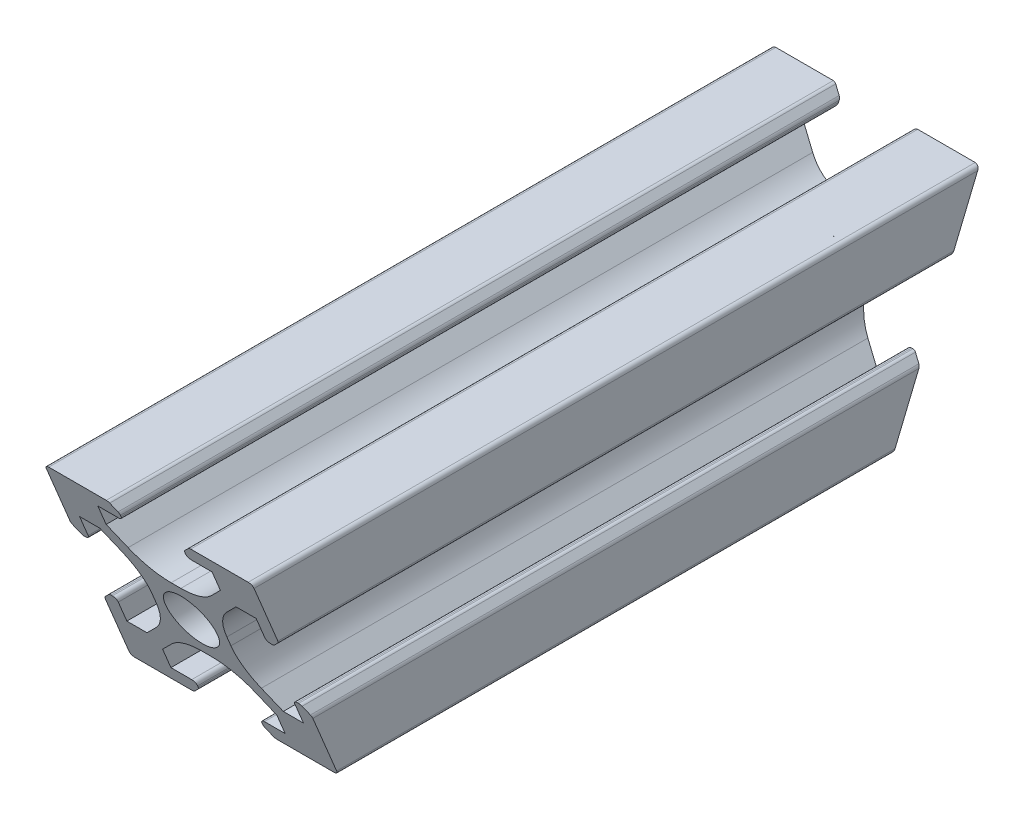
from build123d import *

# Parameters (mm, degrees)
RESSALTO_EXTRUS_O1_DEPTH = 70
PADR_OCIRCULAR1_COUNT    = 4
FILETE1_R                = 0.4
CUT_EXTRUDE1_DEPTH       = 74.484692283
SKETCH2_R                = 1.5
CUT_EXTRUDE2_DEPTH       = 74.484692283


with BuildPart() as part:
    # Esboço1 → Ressalto-extrusão1 (new body)
    with BuildSketch(Plane.XY):
        with BuildLine():
            ThreePointArc((-9.317157288, 3.217157288), (-9.187387948, 3.130448187), (-9.034314575, 3.1))
            Line((-9.034314575, 3.1), (-8.9, 3.1))
            ThreePointArc((-8.9, 3.1), (-8.617157288, 3.217157288), (-8.5, 3.5))
            Line((-8.5, 3.5), (-8.5, 5.5))
            Line((-8.5, 5.5), (-6.560660172, 5.5))
            Line((-6.560660172, 5.5), (-5.064466094, 4.003805922))
            ThreePointArc((-5.064466094, 4.003805922), (-3.980602337, 2.381689178), (-3.6, 0.468272016))
            Line((-3.6, 0.468272016), (-3.6, 0))
            Line((-3.6, 0), (-2.5, 0))
            ThreePointArc((-2.5, 0), (-1.767766953, 1.767766953), (0, 2.5))
            Line((0, 2.5), (0, 3.6))
            Line((0, 3.6), (-0.468272016, 3.6))
            ThreePointArc((-0.468272016, 3.6), (-2.381689178, 3.980602337), (-4.003805922, 5.064466094))
            Line((-4.003805922, 5.064466094), (-5.5, 6.560660172))
            Line((-5.5, 6.560660172), (-5.5, 8.5))
            Line((-5.5, 8.5), (-3.5, 8.5))
            ThreePointArc((-3.5, 8.5), (-3.217157288, 8.617157288), (-3.1, 8.9))
            Line((-3.1, 8.9), (-3.1, 9.034314575))
            ThreePointArc((-3.1, 9.034314575), (-3.130448187, 9.187387948), (-3.217157288, 9.317157288))
            Line((-3.217157288, 9.317157288), (-3.782842712, 9.882842712))
            ThreePointArc((-3.782842712, 9.882842712), (-3.912612052, 9.969551813), (-4.065685425, 10))
            Line((-4.065685425, 10), (-10, 10))
            Line((-10, 10), (-10, 4.065685425))
            ThreePointArc((-10, 4.065685425), (-9.969551813, 3.912612052), (-9.882842712, 3.782842712))
            Line((-9.882842712, 3.782842712), (-9.317157288, 3.217157288))
        make_face()
    ressalto_extrus_o1 = extrude(amount=RESSALTO_EXTRUS_O1_DEPTH)

    # PadrãoCircular1: Ressalto-extrusão1 ×4 about axis
    padr_ocircular1_axis = Axis((0, 0, 0), (0, 0, 1))
    for i in range(1, PADR_OCIRCULAR1_COUNT):
        add(ressalto_extrus_o1.rotate(padr_ocircular1_axis, i * 360 / PADR_OCIRCULAR1_COUNT))

    # Filete1
    filete1_edges = [part.edges().sort_by_distance(p)[0] for p in [
        (-10, -10, 35),
        (-10, 10, 35),
        (10, -10, 35),
        (10, 10, 35),
    ]]
    fillet(filete1_edges, radius=FILETE1_R)

    # Sketch1 → Cut-Extrude1 (cut, through all)
    with BuildSketch(Plane.ZY.offset(10)):
        Polygon((0, 10), (0, -10), (8.284271247, -10), align=None)
        Polygon((70, 10), (61.715728753, -10), (70, -10), align=None)
    extrude(amount=-CUT_EXTRUDE1_DEPTH, mode=Mode.SUBTRACT)

    # Sketch2 → Cut-Extrude2 (cut, through all)
    with BuildSketch(Plane.ZY.offset(10)):
        with Locations((18, 0)):
            Circle(SKETCH2_R)
        with Locations((11, 0)):
            Circle(SKETCH2_R)
        with Locations((52, 0)):
            Circle(SKETCH2_R)
        with Locations((59, 0)):
            Circle(SKETCH2_R)
    extrude(amount=-CUT_EXTRUDE2_DEPTH, mode=Mode.SUBTRACT)


solid = part.part
